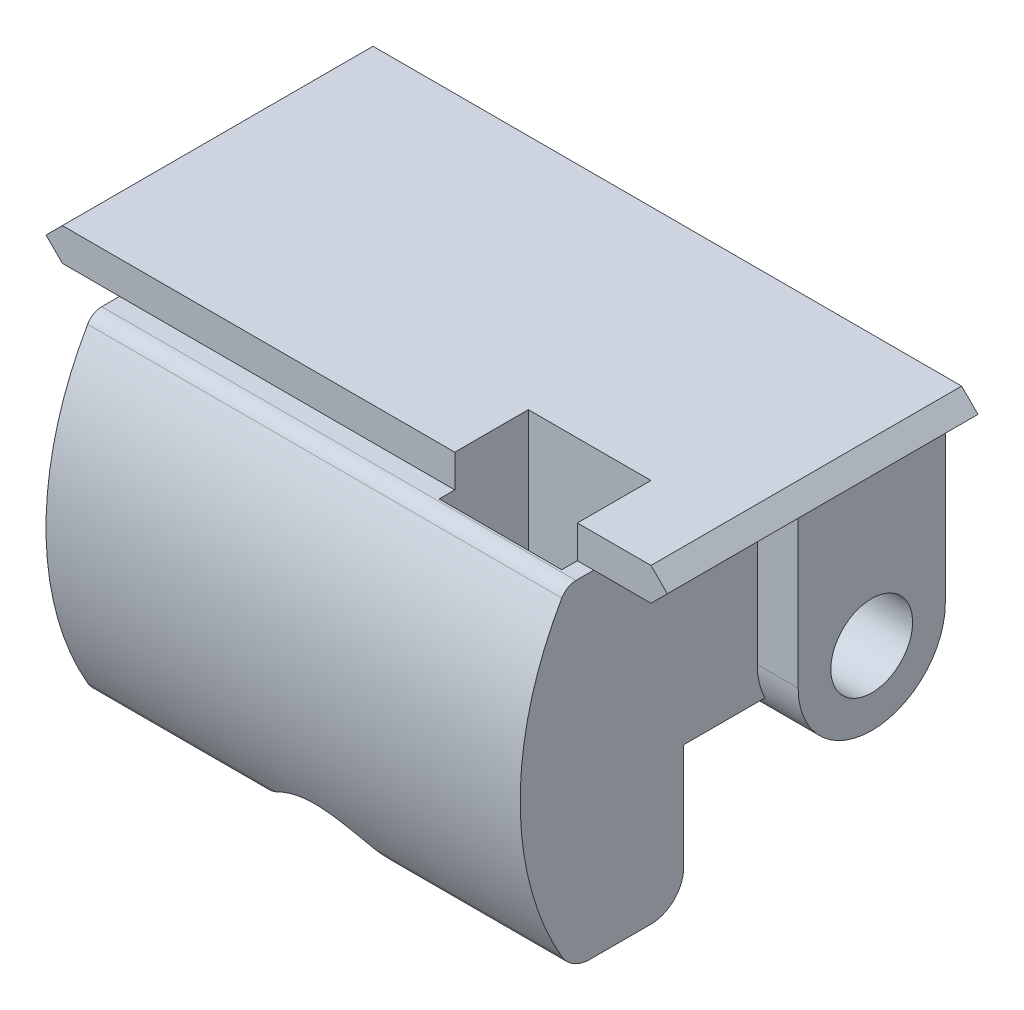
from build123d import *

# Parameters (mm, degrees)
BOSS_EXTRUDE1_DEPTH      = 21.59
BOSS_EXTRUDE1_DEPTH_BACK = 21.59
SKETCH1_R                = 5.715
SKETCH3_W                = 43.18
SKETCH3_H                = 11.43
BOSS_EXTRUDE3_DEPTH      = 12.7
SKETCH4_W                = 36.83
SKETCH4_H                = 15.24
BOSS_EXTRUDE4_DEPTH      = 24.13
SKETCH7_W                = 36.83
SKETCH7_H                = 12.7
BOSS_EXTRUDE5_DEPTH      = 10.795
SKETCH5_R                = 3.175
CUT_EXTRUDE1_DEPTH       = 52.230767367
CUT_EXTRUDE5_DEPTH       = 52.230767367
FILLET1_R                = 2.54
CUT_EXTRUDE6_DEPTH       = 6.35
CUT_EXTRUDE6_DEPTH_BACK  = 6.35
SKETCH10_W               = 22.86
SKETCH10_H               = 25.4
SKETCH11_R               = 1.778
CUT_EXTRUDE7_DEPTH       = 36.017241825
SKETCH24_W               = 48.26
SKETCH24_H               = 24.13
BOSS_EXTRUDE6_DEPTH      = 2.54
SKETCH17_W               = 12.7
SKETCH17_H               = 3.175
CUT_EXTRUDE9_DEPTH       = 8.89
SKETCH18_W               = 9.525
SKETCH18_H               = 6.927192993
CUT_EXTRUDE13_DEPTH      = 45.508925283
CHAMFER1_SIZE            = 1.27
FILLET2_R                = 1.27


with BuildPart() as part:
    # Sketch1 → Boss-Extrude1 (new, two sides: drawn at the far end of the back side and taken through both)
    with BuildSketch(Plane(origin=(0, 0, 0), x_dir=(0, 0, -1), z_dir=(1, 0, 0)).offset(-BOSS_EXTRUDE1_DEPTH_BACK)):
        Circle(SKETCH1_R)
    extrude(amount=BOSS_EXTRUDE1_DEPTH + BOSS_EXTRUDE1_DEPTH_BACK)

    # Sketch3 → Boss-Extrude3 (add)
    with BuildSketch(Plane(origin=(0, 0, 0), x_dir=(1, 0, 0), z_dir=(0, 1, 0))):
        Rectangle(SKETCH3_W, SKETCH3_H)
    extrude(amount=BOSS_EXTRUDE3_DEPTH)


with BuildPart() as body_2:
    # Sketch4 → Boss-Extrude4 (new body)
    with BuildSketch(Plane.XY):
        with Locations((0, 5.08)):
            Rectangle(SKETCH4_W, SKETCH4_H)
    extrude(amount=BOSS_EXTRUDE4_DEPTH)


with BuildPart() as body_3:
    # Sketch7 → Boss-Extrude5 (new body)
    with BuildSketch(Plane.XZ.offset(2.54)):
        with Locations((0, 17.78)):
            Rectangle(SKETCH7_W, SKETCH7_H)
    extrude(amount=BOSS_EXTRUDE5_DEPTH)


with BuildPart() as cut_extrude1_tool:
    # Sketch5 → Cut-Extrude1 (new, through all)
    with BuildSketch(Plane.ZY.offset(21.59)):
        Circle(SKETCH5_R)
    extrude(amount=-CUT_EXTRUDE1_DEPTH)


with BuildPart() as part_1:
    add(part.part)

    # Cut-Extrude1: cut by cut_extrude1_tool
    add(cut_extrude1_tool.part, mode=Mode.SUBTRACT)


with BuildPart() as body_2_1:
    add(body_2.part)

    # Cut-Extrude1: cut by cut_extrude1_tool
    add(cut_extrude1_tool.part, mode=Mode.SUBTRACT)


with BuildPart() as cut_extrude5_tool:
    # Sketch6 → Cut-Extrude5 (new, through all)
    with BuildSketch(Plane(origin=(21.59, 0, 0), x_dir=(0, 0, -1), z_dir=(1, 0, 0))):
        with BuildLine():
            ThreePointArc((-19.445417037, -14.2875), (-24.13, 0), (-19.445417037, 14.2875))
            Line((-19.445417037, 14.2875), (-27.94, 14.2875))
            Line((-27.94, 14.2875), (-27.94, -14.2875))
            Line((-27.94, -14.2875), (-19.445417037, -14.2875))
        make_face()
    extrude(amount=-CUT_EXTRUDE5_DEPTH)


with BuildPart() as body_2_2:
    add(body_2_1.part)

    # Cut-Extrude5: cut by cut_extrude5_tool
    add(cut_extrude5_tool.part, mode=Mode.SUBTRACT)


with BuildPart() as body_3_1:
    add(body_3.part)

    # Cut-Extrude5: cut by cut_extrude5_tool
    add(cut_extrude5_tool.part, mode=Mode.SUBTRACT)

    # Fillet1
    fillet1_edges = [body_3_1.edges().sort_by_distance(p)[0] for p in [
        (0, -13.335, 20.11056128),
        (0, -13.335, 11.43),
    ]]
    fillet(fillet1_edges, radius=FILLET1_R)


with BuildPart() as cut_extrude6_tool:
    # Sketch10 → Cut-Extrude6 (new, two sides: drawn at the far end of the back side and taken through both)
    with BuildSketch(Plane(origin=(0, 0, 0), x_dir=(0, 0, -1), z_dir=(1, 0, 0)).offset(-CUT_EXTRUDE6_DEPTH_BACK)):
        with Locations((-8.255, -7.62)):
            Rectangle(SKETCH10_W, SKETCH10_H)
    extrude(amount=CUT_EXTRUDE6_DEPTH + CUT_EXTRUDE6_DEPTH_BACK)


with BuildPart() as part_2:
    add(part_1.part)

    # Cut-Extrude6: cut by cut_extrude6_tool
    add(cut_extrude6_tool.part, mode=Mode.SUBTRACT)


with BuildPart() as body_2_3:
    add(body_2_2.part)

    # Cut-Extrude6: cut by cut_extrude6_tool
    add(cut_extrude6_tool.part, mode=Mode.SUBTRACT)

    # Sketch11 → Cut-Extrude7 (cut, through all)
    with BuildSketch(Plane(origin=(0, 0, 0), x_dir=(0, 0, -1), z_dir=(1, 0, 0))):
        with Locations((-14.2875, 0)):
            Circle(SKETCH11_R)
    extrude(amount=-CUT_EXTRUDE7_DEPTH, mode=Mode.SUBTRACT)


with BuildPart() as body_3_2:
    add(body_3_1.part)

    # Cut-Extrude6: cut by cut_extrude6_tool
    add(cut_extrude6_tool.part, mode=Mode.SUBTRACT)


with BuildPart() as body_2_4:
    add(body_2_3.part)

    # Combine1: union body 3, part
    add(body_3_2.part)
    add(part_2.part)

    # Sketch24 → Boss-Extrude6 (add)
    with BuildSketch(Plane(origin=(0, 12.7, 0), x_dir=(1, 0, 0), z_dir=(0, 1, 0))):
        with Locations((0, -6.35)):
            Rectangle(SKETCH24_W, SKETCH24_H)
    extrude(amount=BOSS_EXTRUDE6_DEPTH)

    # Sketch17 → Cut-Extrude9 (cut)
    with BuildSketch(Plane(origin=(0, -10.005646771, -1.764265485), x_dir=(-1, 0, 0), z_dir=(0, 0.984807753012208, 0.17364817766693072))):
        with BuildLine():
            Line((-6.35, 21.666839892), (6.35, 21.666839892))
            ThreePointArc((6.35, 21.666839892), (0, 23.193431999), (-6.35, 21.666839892))
        make_face()
        with Locations((0, 20.079339892)):
            Rectangle(SKETCH17_W, SKETCH17_H)
    extrude(amount=CUT_EXTRUDE9_DEPTH, mode=Mode.SUBTRACT)

    # Sketch18 → Cut-Extrude13 (cut, through all)
    with BuildSketch(Plane(origin=(0, -13.335, 0), x_dir=(1, 0, 0), z_dir=(0, 1, 0))):
        with Locations((12.3825, -16.163596497)):
            Rectangle(SKETCH18_W, SKETCH18_H)
    extrude(amount=CUT_EXTRUDE13_DEPTH, mode=Mode.SUBTRACT)

    # Chamfer1
    chamfer1_edges = [body_2_4.edges().sort_by_distance(p)[0] for p in [
        (24.13, 15.24, 6.35),
        (24.13, 12.7, 6.35),
        (-24.13, 15.24, 6.35),
        (-24.13, 12.7, 6.35),
    ]]
    chamfer(chamfer1_edges, length=CHAMFER1_SIZE - 0.0001)  # a hair under: the kernel refuses the full size

    # Fillet2
    fillet2_edges = [body_2_4.edges().sort_by_distance(p)[0] for p in [
        (0, 12.7, 20.517477915),
    ]]
    fillet(fillet2_edges, radius=FILLET2_R)


solid = body_2_4.part
